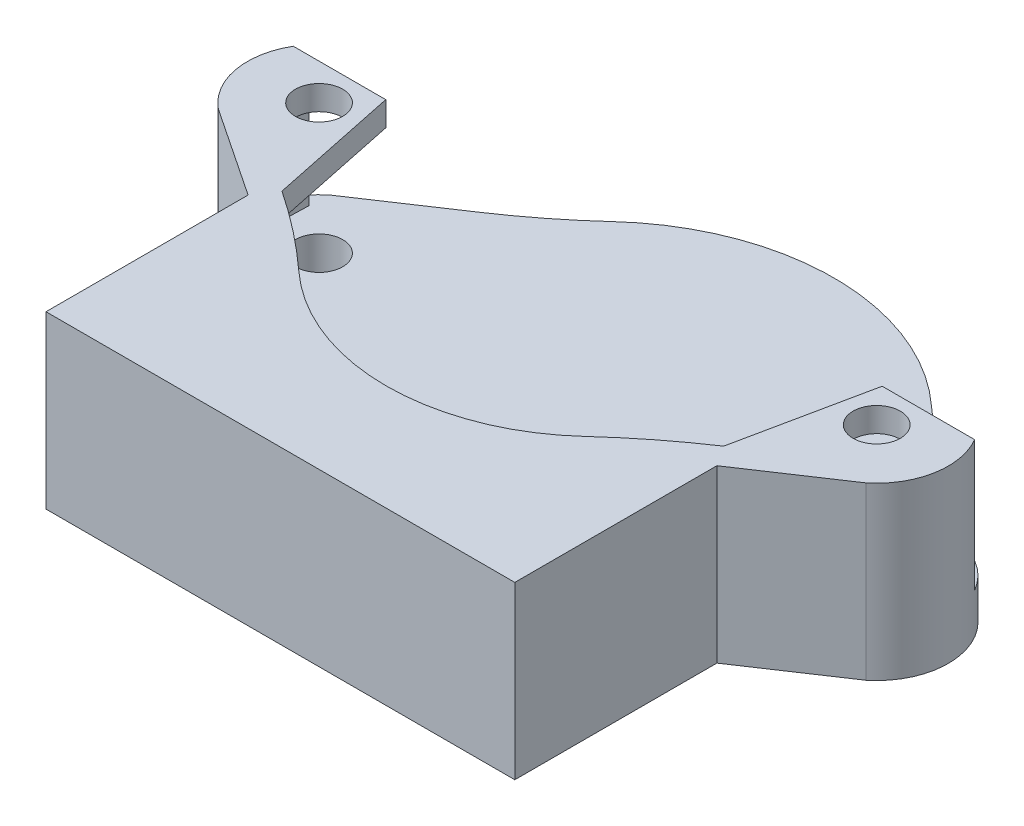
from build123d import *

# Parameters (mm, degrees)
SKETCH1_R           = 2.9
BOSS_EXTRUDE1_DEPTH = 5
BOSS_EXTRUDE2_DEPTH = 13
SKETCH4_R           = 2.9
BOSS_EXTRUDE3_DEPTH = 3
BOSS_EXTRUDE4_DEPTH = 21


with BuildPart() as part:
    # Sketch1 → Boss-Extrude1 (new body)
    with BuildSketch(Plane(origin=(0, 0, 0), x_dir=(1, 0, 0), z_dir=(0, 1, 0))):
        with BuildLine():
            Line((62.90038715, 19.069123632), (73.88721774, 26.399609553))
            ThreePointArc((73.88721774, 26.399609553), (77.156269753, 33.244214317), (73.88721774, 40.088819081))
            Line((73.88721774, 40.088819081), (62.90038715, 47.419305002))
            ThreePointArc((62.90038715, 47.419305002), (58.150415973, 50.856886947), (53.675790472, 54.645939921))
            ThreePointArc((53.675790472, 54.645939921), (34.106269753, 62.244214317), (14.536749034, 54.645939921))
            ThreePointArc((14.536749034, 54.645939921), (10.062123533, 50.856886947), (5.312152356, 47.419305002))
            Line((5.312152356, 47.419305002), (-5.674678234, 40.088819081))
            ThreePointArc((-5.674678234, 40.088819081), (-8.943730247, 33.244214317), (-5.674678234, 26.399609553))
            Line((-5.674678234, 26.399609553), (5.312152356, 19.069123632))
            ThreePointArc((5.312152356, 19.069123632), (10.062123533, 15.631541687), (14.536749034, 11.842488713))
            ThreePointArc((14.536749034, 11.842488713), (34.106269753, 4.244214317), (53.675790472, 11.842488713))
            ThreePointArc((53.675790472, 11.842488713), (58.150415973, 15.631541687), (62.90038715, 19.069123632))
        make_face()
        with Locations((68.356269753, 33.244214317)):
            Circle(SKETCH1_R, mode=Mode.SUBTRACT)
        with Locations((-0.143730247, 33.244214317)):
            Circle(SKETCH1_R, mode=Mode.SUBTRACT)
    extrude(amount=BOSS_EXTRUDE1_DEPTH)

    # Sketch3 → Boss-Extrude2 (add)
    with BuildSketch(Plane(origin=(0, 5, 0), x_dir=(1, 0, 0), z_dir=(0, 1, 0))):
        with BuildLine():
            Line((62.90038715, 19.069123632), (73.88721774, 26.399609553))
            ThreePointArc((73.88721774, 26.399609553), (77.011551697, 31.654845113), (75.9581291, 37.677242003))
            Line((75.9581291, 37.677242003), (74.027243913, 37.677242003))
            Line((74.027243913, 37.677242003), (74.156269753, 33.244214317))
            ThreePointArc((74.156269753, 33.244214317), (73.616142187, 30.800090348), (72.096358727, 28.811186631))
            Line((72.096358727, 28.811186631), (61.235353843, 21.564652451))
            ThreePointArc((61.235353843, 21.564652451), (56.300318854, 17.993138742), (51.651357294, 14.056460327))
            ThreePointArc((51.651357294, 14.056460327), (34.106269753, 7.244214317), (16.561182212, 14.056460327))
            ThreePointArc((16.561182212, 14.056460327), (11.912220652, 17.993138742), (6.977185663, 21.564652451))
            Line((6.977185663, 21.564652451), (-3.883819221, 28.811186631))
            ThreePointArc((-3.883819221, 28.811186631), (-5.403602681, 30.800090348), (-5.943730247, 33.244214317))
            Line((-5.943730247, 33.244214317), (-5.814704408, 37.677242003))
            Line((-5.814704408, 37.677242003), (-7.745589594, 37.677242003))
            ThreePointArc((-7.745589594, 37.677242003), (-8.799012191, 31.654845113), (-5.674678234, 26.399609553))
            Line((-5.674678234, 26.399609553), (5.312152356, 19.069123632))
            ThreePointArc((5.312152356, 19.069123632), (10.062123533, 15.631541687), (14.536749034, 11.842488713))
            ThreePointArc((14.536749034, 11.842488713), (34.106269753, 4.244214317), (53.675790472, 11.842488713))
            ThreePointArc((53.675790472, 11.842488713), (58.150415973, 15.631541687), (62.90038715, 19.069123632))
        make_face()
    extrude(amount=BOSS_EXTRUDE2_DEPTH)

    # Sketch4 → Boss-Extrude3 (add)
    with BuildSketch(Plane(origin=(0, 18, 0), x_dir=(1, 0, 0), z_dir=(0, 1, 0))):
        with BuildLine():
            Line((3.616180779, 37.677242003), (-7.745589594, 37.677242003))
            ThreePointArc((-7.745589594, 37.677242003), (-8.799012191, 31.654845113), (-5.674678234, 26.399609553))
            Line((-5.674678234, 26.399609553), (5.312152356, 19.069123632))
            ThreePointArc((5.312152356, 19.069123632), (10.062123533, 15.631541687), (14.536749034, 11.842488713))
            ThreePointArc((14.536749034, 11.842488713), (34.106269753, 4.244214317), (53.675790472, 11.842488713))
            ThreePointArc((53.675790472, 11.842488713), (58.150415973, 15.631541687), (62.90038715, 19.069123632))
            Line((62.90038715, 19.069123632), (73.88721774, 26.399609553))
            ThreePointArc((73.88721774, 26.399609553), (77.011551697, 31.654845113), (75.9581291, 37.677242003))
            Line((75.9581291, 37.677242003), (64.596358727, 37.677242003))
            Line((64.596358727, 37.677242003), (61.235353843, 21.564652451))
            ThreePointArc((61.235353843, 21.564652451), (56.300318854, 17.993138742), (51.651357294, 14.056460327))
            ThreePointArc((51.651357294, 14.056460327), (34.106269753, 7.244214317), (16.561182212, 14.056460327))
            ThreePointArc((16.561182212, 14.056460327), (11.912220652, 17.993138742), (6.977185663, 21.564652451))
            Line((6.977185663, 21.564652451), (3.616180779, 37.677242003))
        make_face()
        with Locations((-0.143730247, 33.244214317)):
            Circle(SKETCH4_R, mode=Mode.SUBTRACT)
        with Locations((68.356269753, 33.244214317)):
            Circle(SKETCH4_R, mode=Mode.SUBTRACT)
    extrude(amount=BOSS_EXTRUDE3_DEPTH)

    # Sketch5 → Boss-Extrude4 (add)
    with BuildSketch(Plane.XZ):
        with BuildLine():
            Line((62.90038715, -19.069123632), (62.90038715, 5.755785683))
            Line((62.90038715, 5.755785683), (5.312152356, 5.755785683))
            Line((5.312152356, 5.755785683), (5.312152356, -19.069123632))
            ThreePointArc((5.312152356, -19.069123632), (10.062123533, -15.631541687), (14.536749034, -11.842488713))
            ThreePointArc((14.536749034, -11.842488713), (34.106269753, -4.244214317), (53.675790472, -11.842488713))
            ThreePointArc((53.675790472, -11.842488713), (58.150415973, -15.631541687), (62.90038715, -19.069123632))
        make_face()
    extrude(amount=-BOSS_EXTRUDE4_DEPTH)


solid = part.part
